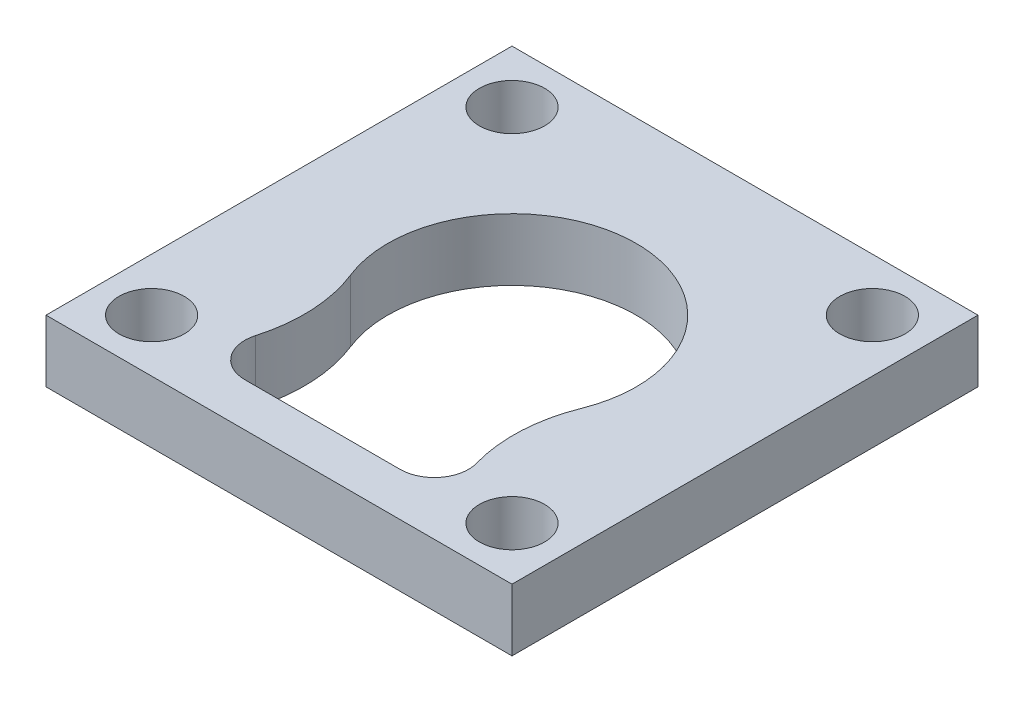
from build123d import *

# Parameters (mm, degrees)
SKETCH1_W                          = 30
SKETCH1_H                          = 30
BOSS_EXTRUDE1_DEPTH                = 4
F_4_2_4_2_DIAMETER_HOLE1_OUTLINE_R = 2.1
F_4_2_4_2_DIAMETER_HOLE1_DEPTH     = 4
SKETCH7_R                          = 8
CUT_EXTRUDE1_DEPTH                 = 22.587033145
FILLET1_R                          = 10


# Read off the part's stored shape, not the designer's step: Ø4.2 (4.2) Diameter Hole1
with BuildPart() as part:
    # Sketch1 → Boss-Extrude1 (new body)
    with BuildSketch(Plane(origin=(0, 0, 0), x_dir=(1, 0, 0), z_dir=(0, 1, 0))):
        Rectangle(SKETCH1_W, SKETCH1_H)
    extrude(amount=BOSS_EXTRUDE1_DEPTH)

    # Ø4.2 (4.2) Diameter Hole1 outline → Ø4.2 (4.2) Diameter Hole1 (cut)
    with BuildSketch(Plane(origin=(0, 0, 0), x_dir=(1, 0, 0), z_dir=(0, 1, 0))):
        with Locations((11.6, -11.6)):
            Circle(F_4_2_4_2_DIAMETER_HOLE1_OUTLINE_R)
        with Locations((-11.6, 11.6)):
            Circle(F_4_2_4_2_DIAMETER_HOLE1_OUTLINE_R)
        with Locations((-11.6, -11.6)):
            Circle(F_4_2_4_2_DIAMETER_HOLE1_OUTLINE_R)
        with Locations((11.6, 11.6)):
            Circle(F_4_2_4_2_DIAMETER_HOLE1_OUTLINE_R)
    extrude(amount=F_4_2_4_2_DIAMETER_HOLE1_DEPTH, mode=Mode.SUBTRACT)

    # Sketch7 → Cut-Extrude1 (cut, through all)
    with BuildSketch(Plane.XZ):
        with BuildLine():
            ThreePointArc((1.777638883, 7.8), (0, 8), (-1.777638883, 7.8))
            Line((-1.777638883, 7.8), (1.777638883, 7.8))
        make_face()
        with BuildLine():
            Line((1.777638883, 7.8), (-1.777638883, 7.8))
            ThreePointArc((-1.777638883, 7.8), (-4.988932197, -6.253843261), (8, 0))
            ThreePointArc((8, 0), (6.253843261, 4.988932197), (1.777638883, 7.8))
        make_face()
        Circle(SKETCH7_R)
        with BuildLine():
            Line((-5, 7.8), (5, 7.8))
            ThreePointArc((5, 7.8), (7.2, 10), (5, 12.2))
            Line((5, 12.2), (-5, 12.2))
            ThreePointArc((-5, 12.2), (-7.2, 10), (-5, 7.8))
        make_face()
    extrude(amount=-CUT_EXTRUDE1_DEPTH, mode=Mode.SUBTRACT)

    # Fillet1
    fillet1_edges = [part.edges().sort_by_distance(p)[0] for p in [
        (1.777638883, 2, 7.8),
        (-1.777638883, 2, 7.8),
    ]]
    fillet(fillet1_edges, radius=FILLET1_R)


solid = part.part
